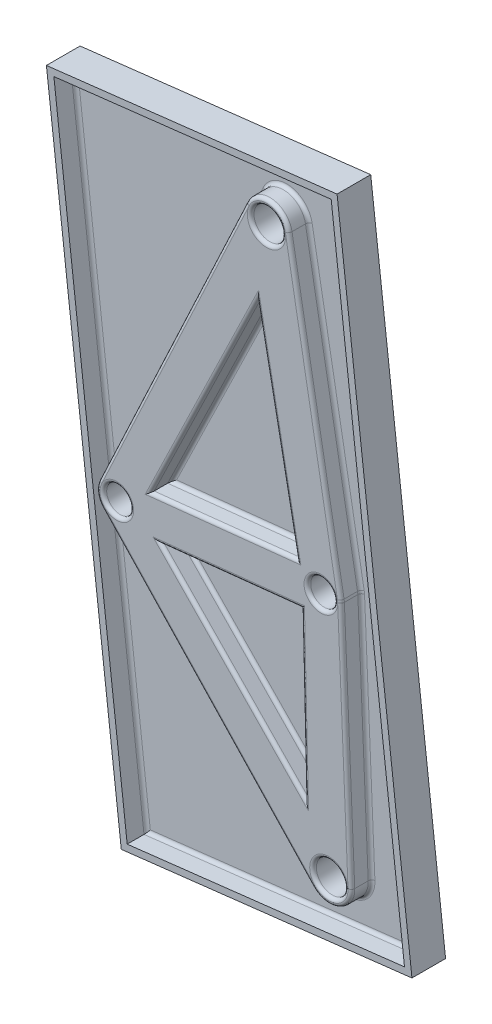
from build123d import *

# Parameters (mm, degrees)
ESQUISSE1_R             = 2
ESQUISSE1_R_2           = 2.35
BOSS_EXTRU_1_DEPTH      = 5
ENL_V_MAT_EXTRU_1_DEPTH = 3
ESQUISSE4_R             = 3
ESQUISSE4_R_2           = 2
ESQUISSE4_R_3           = 3.35
ESQUISSE4_R_4           = 2.35
BOSS_EXTRU_3_DEPTH      = 3
BOSS_EXTRU_4_DEPTH      = 3
ESQUISSE6_R             = 2.5
BOSS_EXTRU_7_DEPTH      = 3
CONG_1_R                = 0.5
CONG_2_R                = 0.5
CONG_3_R                = 0.5
CONG_4_R                = 0.5


# Some blends are built 0.0001 mm under size
with BuildPart() as part:
    # Esquisse1 → Boss.-Extru.1 (new body)
    with BuildSketch(Plane.XY):
        Polygon((31.369885856, 56.474581367), (-11.836841692, 51.431894124), (-0.708152605, -43.920883912), (42.498574943, -38.87819667), align=None)
        with Locations((-1.373903483, 0.601987724)):
            Circle(ESQUISSE1_R, mode=Mode.SUBTRACT)
        with Locations((28.956552282, 3.828493866)):
            Circle(ESQUISSE1_R, mode=Mode.SUBTRACT)
        with Locations((20.874808411, 47.195392317)):
            Circle(ESQUISSE1_R_2, mode=Mode.SUBTRACT)
        with Locations((30.148715983, -32.265256047)):
            Circle(ESQUISSE1_R_2, mode=Mode.SUBTRACT)
    extrude(amount=BOSS_EXTRU_1_DEPTH)

    # Esquisse3 → Enlèv. mat.-Extru.1 (cut)
    with BuildSketch(Plane.XY.offset(5)):
        Polygon((0.169181655, -42.811701963), (41.389392993, -38.00086241), (30.492551596, 55.365399417), (-10.727659743, 50.554559864), align=None)
    extrude(amount=-ENL_V_MAT_EXTRU_1_DEPTH, mode=Mode.SUBTRACT)

    # Esquisse4 → Boss.-Extru.3 (add)
    # profile 1 of 4: a face of its own
    with BuildSketch(Plane.XY.offset(2)):
        with Locations((-1.373903483, 0.601987724)):
            Circle(ESQUISSE4_R)
        with Locations((-1.373903483, 0.601987724)):
            Circle(ESQUISSE4_R_2, mode=Mode.SUBTRACT)
    # profile 2 of 4: a face of its own
    with BuildSketch(Plane.XY.offset(2)):
        with Locations((30.148715983, -32.265256047)):
            Circle(ESQUISSE4_R_3)
        with Locations((30.148715983, -32.265256047)):
            Circle(ESQUISSE4_R_4, mode=Mode.SUBTRACT)
    # profile 3 of 4: a face of its own
    with BuildSketch(Plane.XY.offset(2)):
        with Locations((28.956552282, 3.828493866)):
            Circle(ESQUISSE4_R)
        with Locations((28.956552282, 3.828493866)):
            Circle(ESQUISSE4_R_2, mode=Mode.SUBTRACT)
    # profile 4 of 4: a face of its own
    with BuildSketch(Plane.XY.offset(2)):
        with Locations((20.874808411, 47.195392317)):
            Circle(ESQUISSE4_R_3)
        with Locations((20.874808411, 47.195392317)):
            Circle(ESQUISSE4_R_4, mode=Mode.SUBTRACT)
    extrude(amount=BOSS_EXTRU_3_DEPTH)

    # Esquisse5 → Boss.-Extru.4 (add)
    with BuildSketch(Plane.XY.offset(2)):
        with BuildLine():
            Line((27.713218685, -34.565441455), (-3.554945839, -1.457879806))
            ThreePointArc((-3.554945839, -1.457879806), (0.702665564, -1.563159152), (0.775220023, 2.695135629))
            Line((0.775220023, 2.695135629), (32.548570565, -29.927907552))
            ThreePointArc((32.548570565, -29.927907552), (27.829880548, -29.847508702), (27.713218685, -34.565441455))
        make_face()
    extrude(amount=BOSS_EXTRU_4_DEPTH)

    # Esquisse6 → Boss.-Extru.7 (add)
    with BuildSketch(Plane.XY.offset(2)):
        with BuildLine():
            Line((33.495661081, -32.122222794), (31.953816549, 3.956583346))
            Line((31.953816549, 3.956583346), (31.910045224, 4.354687214))
            Line((31.910045224, 4.354687214), (24.17287553, 47.782974889))
            ThreePointArc((24.17287553, 47.782974889), (20.436541684, 43.874184362), (17.842057521, 48.618389871))
            Line((17.842057521, 48.618389871), (-4.089799802, 1.876313892))
            ThreePointArc((-4.089799802, 1.876313892), (1.069419445, 2.342726954), (-1.056558749, -2.381180445))
            Line((-1.056558749, -2.381180445), (26.033375742, 0.500604146))
            Line((26.033375742, 0.500604146), (26.799627298, -32.343390404))
            ThreePointArc((26.799627298, -32.343390404), (30.038126984, -28.917081907), (33.495661081, -32.122222794))
        make_face()
        with Locations((28.956552282, 3.828493866)):
            Circle(ESQUISSE6_R, mode=Mode.SUBTRACT)
        Polygon((3.688915715, 4.157489262), (25.387139604, 6.465712166), (19.502974618, 36.706132963), align=None, mode=Mode.SUBTRACT)
    extrude(amount=BOSS_EXTRU_7_DEPTH)

    # Congé1
    cong_1_edges = [part.edges().sort_by_distance(p)[0] for p in [
        (-4.33603346, 0.126818282, 5),
        (28.041460377, 26.068831051, 5),
        (6.876128859, 25.247351882, 5),
        (15.558284743, -0.613719547, 5),
        (26.317088635, -11.660238657, 5),
        (32.724738815, -14.082819724, 5),
        (11.595945167, 20.431811112, 5),
        (14.538027659, 5.311600714, 5),
        (22.445057111, 21.585922564, 5),
        (-3.373903483, 0.601987724, 5),
        (27.798715983, -32.265256047, 5),
        (31.938581711, 4.156366535, 5),
        (26.956552282, 3.828493866, 5),
        (21.313075137, 50.516600271, 5),
        (18.524808411, 47.195392317, 5),
        (31.452561691, -35.351108663, 5),
        (12.079136423, -18.011660631, 5),
        (15.841997636, -12.77456235, 5),
    ]]
    fillet(cong_1_edges, radius=CONG_1_R - 0.0001)  # a hair under: the kernel refuses the full size

    # Congé2
    cong_2_edges = [part.edges().sort_by_distance(p)[0] for p in [
        (11.595945167, 20.431811112, 2),
        (14.538027659, 5.311600714, 2),
        (22.445057111, 21.585922564, 2),
    ]]
    fillet(cong_2_edges, radius=CONG_2_R)

    # Congé3
    cong_3_edges = [part.edges().sort_by_distance(p)[0] for p in [
        (15.558284743, -0.613719547, 2),
        (26.317088635, -11.660238657, 2),
        (15.841997636, -12.77456235, 2),
    ]]
    fillet(cong_3_edges, radius=CONG_3_R)

    # Congé4
    # the kernel refuses this fillet: 0.5 mm, written as the material it adds along each edge
    with BuildSketch(Plane(origin=(-1.373903483, 0.601987724, 2), x_dir=(-0.9052987730853533, 0.42477538941204424, 0), z_dir=(0.42477538941204424, 0.9052987730853533, 0))) as cong_4_piece_1:
        with BuildLine():
            CenterArc((3 + CONG_4_R, CONG_4_R), CONG_4_R, 180, 90)
            Line((3 + CONG_4_R, 0), (3, 0))
            Line((3, 0), (3, CONG_4_R))
        make_face()
    revolve(axis=Axis((-1.373903483, 0.601987724, 2), (0, 0, 1)), revolution_arc=68.499789457)
    with BuildSketch(Plane(origin=(33.495661081, -32.122222794, 2), x_dir=(0, 0, 1), z_dir=(-0.042696493365929934, 0.9990880889362325, 0))) as cong_4_piece_2:
        with BuildLine():
            CenterArc((CONG_4_R, CONG_4_R), CONG_4_R, 180, 90)
            Line((0, CONG_4_R), (0, 0))
            Line((0, 0), (CONG_4_R, 0))
        make_face()
    extrude(amount=36.111736833)
    with BuildSketch(Plane(origin=(31.910045224, 4.354687214, 2), x_dir=(0, 0, 1), z_dir=(-0.17539778265308498, 0.9844976474529441, 0))) as cong_4_piece_3:
        with BuildLine():
            CenterArc((CONG_4_R, CONG_4_R), CONG_4_R, 180, 90)
            Line((0, CONG_4_R), (0, 0))
            Line((0, 0), (CONG_4_R, 0))
        make_face()
    extrude(amount=44.112129457)
    with BuildSketch(Plane(origin=(17.842057521, 48.618389871, 2), x_dir=(0, 0, 1), z_dir=(-0.4247753894120441, -0.9052987730853534, 0))) as cong_4_piece_4:
        with BuildLine():
            CenterArc((CONG_4_R, CONG_4_R), CONG_4_R, 180, 90)
            Line((0, CONG_4_R), (0, 0))
            Line((0, 0), (CONG_4_R, 0))
        make_face()
    extrude(amount=51.63165727)
    with BuildSketch(Plane(origin=(41.534297799, -39.24243504, 2), x_dir=(-0.9932581045430172, -0.1159238446550701, 0), z_dir=(-0.1159238446550701, 0.9932581045430172, 0))) as cong_4_piece_5_section:
        with BuildLine():
            CenterArc((CONG_4_R, CONG_4_R), CONG_4_R, 180, 90)
            Line((0, CONG_4_R), (0, 0))
            Line((0, 0), (CONG_4_R, 0))
        make_face()
    cong_4_piece_5 = extrude(amount=96.5, mode=Mode.PRIVATE)
    cong_4_piece_5 = split(cong_4_piece_5, bisect_by=Plane(origin=(30.265696743, 56.345710687, 2.111683969), z_dir=(0.11592384465507002, -0.9932581045430172, 0)), keep=Keep.TOP, mode=Mode.PRIVATE)
    cong_4_piece_5 = split(cong_4_piece_5, bisect_by=Plane(origin=(41.39438583, -39.007067349, 2.111683969), z_dir=(-0.11592384465507001, 0.9932581045430172, 0)), keep=Keep.TOP, mode=Mode.PRIVATE)
    add(cong_4_piece_5)
    with BuildSketch(Plane(origin=(-1.072390976, -42.956606769, 2), x_dir=(-0.11592384465506991, 0.9932581045430172, 0), z_dir=(0.9932581045430172, 0.11592384465506991, 0))) as cong_4_piece_6_section:
        with BuildLine():
            CenterArc((CONG_4_R, CONG_4_R), CONG_4_R, 180, 90)
            Line((0, CONG_4_R), (0, 0))
            Line((0, 0), (CONG_4_R, 0))
        make_face()
    cong_4_piece_6 = extrude(amount=44, mode=Mode.PRIVATE)
    cong_4_piece_6 = split(cong_4_piece_6, bisect_by=Plane(origin=(-0.837023285, -42.8166948, 2.111683969), z_dir=(0.9932581045430172, 0.11592384465507, 0)), keep=Keep.TOP, mode=Mode.PRIVATE)
    cong_4_piece_6 = split(cong_4_piece_6, bisect_by=Plane(origin=(42.369704263, -37.774007557, 2.111683969), z_dir=(-0.9932581045430172, -0.11592384465507008, 0)), keep=Keep.TOP, mode=Mode.PRIVATE)
    add(cong_4_piece_6)
    with BuildSketch(Plane(origin=(-10.872564549, 51.796132495, 2), x_dir=(0.9932581045430172, 0.11592384465507, 0), z_dir=(0.11592384465507, -0.9932581045430172, 0))) as cong_4_piece_7_section:
        with BuildLine():
            CenterArc((CONG_4_R, CONG_4_R), CONG_4_R, 180, 90)
            Line((0, CONG_4_R), (0, 0))
            Line((0, 0), (CONG_4_R, 0))
        make_face()
    cong_4_piece_7 = extrude(amount=96.5, mode=Mode.PRIVATE)
    cong_4_piece_7 = split(cong_4_piece_7, bisect_by=Plane(origin=(-10.73265258, 51.560764804, 2.111683969), z_dir=(0.11592384465507002, -0.9932581045430172, 0)), keep=Keep.TOP, mode=Mode.PRIVATE)
    cong_4_piece_7 = split(cong_4_piece_7, bisect_by=Plane(origin=(0.396036507, -43.792013232, 2.111683969), z_dir=(-0.11592384465507001, 0.9932581045430172, 0)), keep=Keep.TOP, mode=Mode.PRIVATE)
    add(cong_4_piece_7)
    with BuildSketch(Plane(origin=(31.734124226, 55.510304223, 2), x_dir=(0.11592384465506991, -0.9932581045430172, 0), z_dir=(-0.9932581045430172, -0.11592384465506993, 0))) as cong_4_piece_8_section:
        with BuildLine():
            CenterArc((CONG_4_R, CONG_4_R), CONG_4_R, 180, 90)
            Line((0, CONG_4_R), (0, 0))
            Line((0, 0), (CONG_4_R, 0))
        make_face()
    cong_4_piece_8 = extrude(amount=44, mode=Mode.PRIVATE)
    cong_4_piece_8 = split(cong_4_piece_8, bisect_by=Plane(origin=(-11.707971012, 50.327705012, 2.111683969), z_dir=(0.9932581045430172, 0.11592384465507, 0)), keep=Keep.TOP, mode=Mode.PRIVATE)
    cong_4_piece_8 = split(cong_4_piece_8, bisect_by=Plane(origin=(31.498756535, 55.370392254, 2.111683969), z_dir=(-0.9932581045430172, -0.11592384465507008, 0)), keep=Keep.TOP, mode=Mode.PRIVATE)
    add(cong_4_piece_8)
    with BuildSketch(Plane(origin=(28.956552282, 3.828493866, 2), x_dir=(0.9990880889362325, 0.042696493365931974, 0), z_dir=(0.042696493365931974, -0.9990880889362325, 0))) as cong_4_piece_9:
        with BuildLine():
            CenterArc((3 + CONG_4_R, CONG_4_R), CONG_4_R, 180, 90)
            Line((3 + CONG_4_R, 0), (3, 0))
            Line((3, 0), (3, CONG_4_R))
        make_face()
    revolve(axis=Axis((28.956552282, 3.828493866, 2), (0, 0, 1)), revolution_arc=7.654734672)
    with BuildSketch(Plane(origin=(20.874808411, 47.195392317, 2), x_dir=(0.9844976474529449, 0.17539778265307968, 0), z_dir=(0.17539778265307968, -0.9844976474529449, 0))) as cong_4_piece_10:
        with BuildLine():
            CenterArc((3.35 + CONG_4_R, CONG_4_R), CONG_4_R, 180, 90)
            Line((3.35 + CONG_4_R, 0), (3.35, 0))
            Line((3.35, 0), (3.35, CONG_4_R))
        make_face()
    revolve(axis=Axis((20.874808411, 47.195392317, 2), (0, 0, 1)), revolution_arc=144.761745451)
    with BuildSketch(Plane(origin=(30.148715983, -32.265256047, 2), x_dir=(0.9990880889362325, 0.0426964933659299, 0), z_dir=(-0.0426964933659299, 0.9990880889362325, 0))) as cong_4_piece_11:
        with BuildLine():
            CenterArc((3.35 + CONG_4_R, -CONG_4_R), CONG_4_R, 90, 90)
            Line((3.35 + CONG_4_R, 0), (3.35, 0))
            Line((3.35, 0), (3.35, -CONG_4_R))
        make_face()
    revolve(axis=Axis((30.148715983, -32.265256047, 2), (0, 0, -1)), revolution_arc=139.08373042)
    with BuildSketch(Plane(origin=(27.713218685, -34.565441455, 2), x_dir=(0, 0, 1), z_dir=(-0.6866225099236372, 0.727014118752975, 0))) as cong_4_piece_12:
        with BuildLine():
            CenterArc((CONG_4_R, -CONG_4_R), CONG_4_R, 90, 90)
            Line((0, -CONG_4_R), (0, 0))
            Line((0, 0), (CONG_4_R, 0))
        make_face()
    extrude(amount=45.539090363)


solid = part.part
